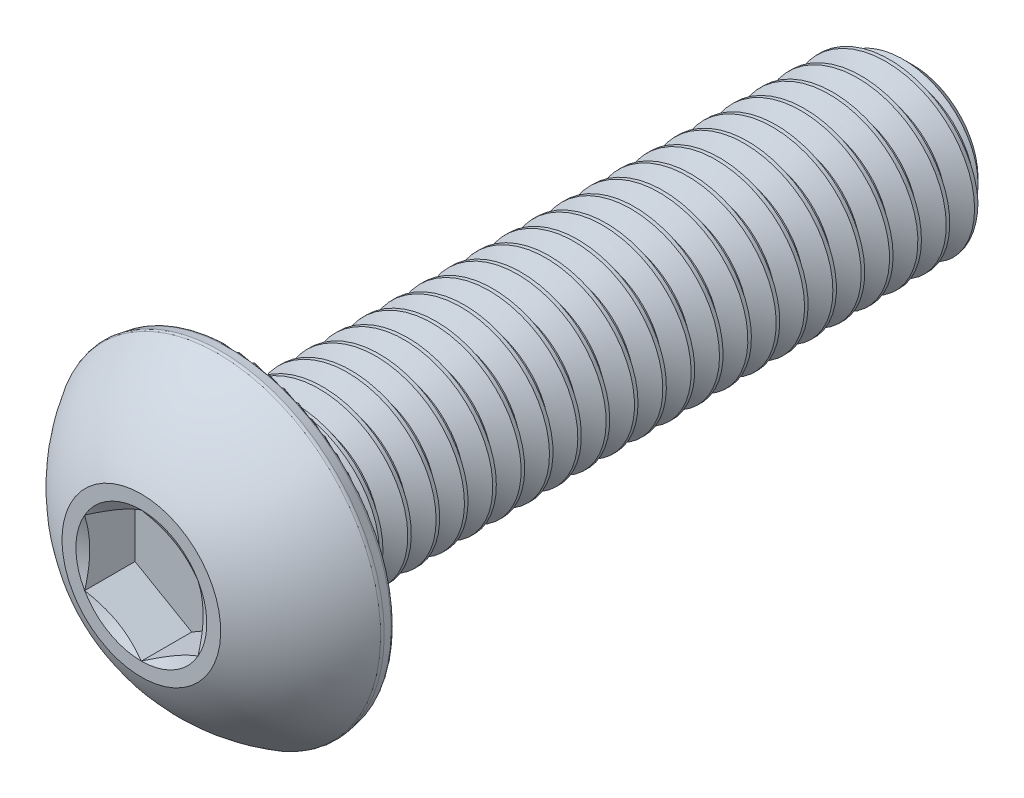
from build123d import *

# Parameters (mm, degrees)
CUT_EXTRUDE1_DEPTH = 1.41097
FILLET1_R          = 0.12827
CUT_SWEEP1_PITCH   = 0.79375
CUT_SWEEP1_TO      = 19.05


with BuildPart() as part:
    # Sketch3 → Revolve1 (revolve)
    with BuildSketch(Plane(origin=(0, 0, 0), x_dir=(0, 0, -1), z_dir=(1, 0, 0)), mode=Mode.PRIVATE) as revolve1_sk:
        with BuildLine():
            Line((-10.8077, 0), (-10.8077, 2.2225))
            ThreePointArc((-10.8077, 2.2225), (-9.90196038, 3.573966445), (-8.62711, 4.5847))
            Line((-8.62711, 4.5847), (-8.2423, 4.516847615))
            Line((-8.2423, 4.516847615), (-8.2423, 2.413))
            Line((-8.2423, 2.413), (10.2123875, 2.413))
            Line((10.2123875, 2.413), (10.8077, 1.8176875))
            Line((10.8077, 1.8176875), (10.8077, 0))
            Line((10.8077, 0), (-10.8077, 0))
        make_face()
    revolve(revolve1_sk.sketch.rotate(Axis((0, 0, 10.8077), (0, 0, -1)), 90), axis=Axis((0, 0, 10.8077), (0, 0, -1)))

    # Sketch4 → Cut-Extrude1 (cut)
    with BuildSketch(Plane.XY.offset(10.8077)):
        Polygon((-1.5875, -0.916543552), (0, -1.833087105), (1.5875, -0.916543552), (1.5875, 0.916543552), (0, 1.833087105), (-1.5875, 0.916543552), align=None)
    extrude(amount=-CUT_EXTRUDE1_DEPTH, mode=Mode.SUBTRACT)

    # Cut-Extrude2 cone 1 section (through the dimple's axis) → Cut-Extrude2 (revolve, cut)
    with BuildSketch(Plane(origin=(0, 0, 10.8077), x_dir=(0, -1, 0), z_dir=(1, 0, 0))):
        Polygon((0, 0), (1.833087105, 0), (0, 1.058333333), align=None)
    revolve(axis=Axis((0, 0, 10.8077), (0, 0, -1)), mode=Mode.SUBTRACT)

    # Fillet1
    fillet1_edges = [part.edges().sort_by_distance(p)[0] for p in [
        (-4.516847615, 0, 8.2423),
        (-4.5847, 0, 8.62711),
    ]]
    fillet(fillet1_edges, radius=FILLET1_R)


with BuildPart() as body_2:
    # Split1: read off the stored shape, not the designer's step
    # Split1: the piece on the far side of the plane
    add(part.part)
    split(bisect_by=Plane.XY.offset(8.2423), keep=Keep.BOTTOM)

    # Cut-Sweep1: arcs per turn and ends read off the stored shape
    # Cut-Sweep1: the profile of Sketch7 screwed along a right-hand helix through 25 turns, 8 arcs to a turn; built about Z, then put on its axis
    cut_sweep1_z = Axis((0, 0, 0), (0, 0, 1))
    cut_sweep1_corners = [(2.455962979, 0, 0.024804687), (2.455962979, 0, -0.719335938), (1.897444252, 0, -0.396875), (1.897444252, 0, -0.29765625)]
    with BuildLine(mode=Mode.PRIVATE) as cut_sweep1_profile:
        Line(cut_sweep1_corners[0], cut_sweep1_corners[1])
        Line(cut_sweep1_corners[1], cut_sweep1_corners[2])
        Line(cut_sweep1_corners[2], cut_sweep1_corners[3])
        Line(cut_sweep1_corners[3], cut_sweep1_corners[0])
    cut_sweep1_cap = Face(cut_sweep1_profile.wire())
    cut_sweep1_turn_angles = [0, 22.5, 45, 67.5, 90, 112.5, 135, 157.5, 180, 202.5, 225, 247.5, 270, 292.5, 315, 337.5, 360]
    cut_sweep1_turn_weights = [1, 0.9238795325112867, 1, 0.9238795325112867, 1, 0.9238795325112867, 1, 0.9238795325112867, 1, 0.9238795325112867, 1, 0.9238795325112867, 1, 0.9238795325112867, 1, 0.9238795325112867, 1]
    cut_sweep1_turn_rails = [Edge.make_bspline([Vector(p[0], p[1], 0).rotate(cut_sweep1_z, cut_sweep1_turn_angles[k]) / cut_sweep1_turn_weights[k] + Vector(0, 0, p[2] + CUT_SWEEP1_PITCH * cut_sweep1_turn_angles[k] / 360) for k in range(17)], [0, 0, 0, 1, 1, 2, 2, 3, 3, 4, 4, 5, 5, 6, 6, 7, 7, 8, 8, 8], 2, cut_sweep1_turn_weights) for p in cut_sweep1_corners]
    cut_sweep1_turn_sides = [Face.make_surface_from_curves(cut_sweep1_turn_rails[p[0]], cut_sweep1_turn_rails[p[1]]) for p in [(0, 1), (1, 2), (2, 3), (3, 0)]]
    cut_sweep1 = Plane(origin=(0, 0, -10.8077), x_dir=(0, 1, 0), z_dir=(0, 0, 1)) * split(Solid(Shell([*[p.moved(Location((0, 0, CUT_SWEEP1_PITCH * i))) for i in range(25) for p in cut_sweep1_turn_sides], cut_sweep1_cap, cut_sweep1_cap.rotate(cut_sweep1_z, 9000).moved(Location((0, 0, CUT_SWEEP1_PITCH * 9000 / 360)))])), bisect_by=Plane.XY.offset(CUT_SWEEP1_TO), keep=Keep.BOTTOM, mode=Mode.PRIVATE)
    add(cut_sweep1, mode=Mode.SUBTRACT)


with BuildPart() as part_1:
    add(part.part)

    # Split1
    split(bisect_by=Plane.XY.offset(8.2423), keep=Keep.TOP)

    add(body_2.part)  # Boss-Extrude1 merges body 2
    # Boss-Extrude1: read off the stored shape, not the designer's step
    # Boss-Extrude1 outline → Boss-Extrude1 (revolve)
    with BuildSketch(Plane.XZ):
        Polygon((1.897438552, 8.2423), (1.897438552, 7.640812594), (2.498925958, 8.2423), align=None)
    revolve(axis=Axis((0, 0, 0), (0, 0, 1)))


solid = part_1.part
